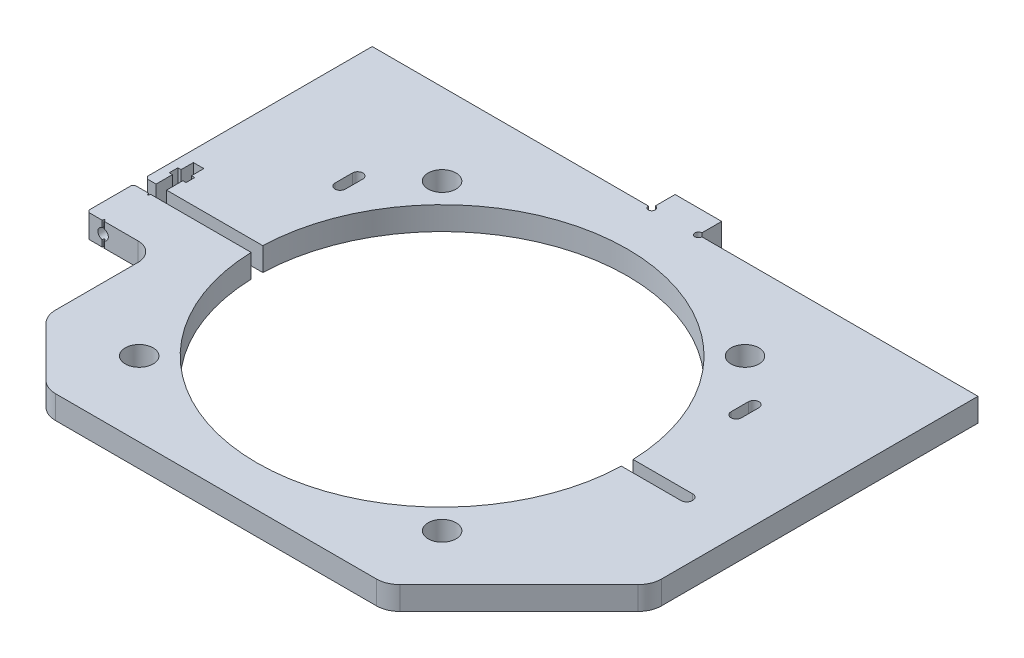
from build123d import *

# Parameters (mm, degrees)
SKETCH1_W                  = 260
SKETCH1_H                  = 200
EXTRUDE1_DEPTH             = 10
SKETCH2_R                  = 79.5
EXTRUDE2_DEPTH             = 10
M4_CLEARANCE_HOLE2_DEPTH   = 10
EXTRUDE3_DEPTH             = 10
SKETCH6_W                  = 30
SKETCH6_H                  = 77.5
EXTRUDE4_DEPTH             = 10
FILLET1_R                  = 8
M4_CLEARANCE_HOLE3_D       = 4.5
M4_CLEARANCE_HOLE3_DEPTH   = 20
EXTRUDE5_DEPTH             = 10
F_12_0_12_DIAMETER_HOLE1_D = 12
CHAMFER1_SIZE              = 30
CHAMFER2_SIZE              = 1
CHAMFER3_SIZE              = 60
SKETCH16_W                 = 146
SKETCH16_H                 = 3
EXTRUDE6_DEPTH             = 10
FILLET4_R                  = 10
EXTRUDE7_DEPTH             = 10
SKETCH18_W                 = 20
SKETCH18_H                 = 10
EXTRUDE8_DEPTH             = 10
EXTRUDE9_DEPTH             = 10


# Read off the part's stored shape, not the designer's step: M4 Clearance Hole2
with BuildPart() as part:
    # Sketch1 → Extrude1 (new body)
    with BuildSketch(Plane(origin=(0, 0, 0), x_dir=(1, 0, 0), z_dir=(0, 1, 0))):
        Rectangle(SKETCH1_W, SKETCH1_H)
    extrude(amount=EXTRUDE1_DEPTH)

    # Sketch2 → Extrude2 (cut)
    with BuildSketch(Plane(origin=(0, 10, 0), x_dir=(1, 0, 0), z_dir=(0, 1, 0))):
        with Locations(Location((0, 0, 0), (0, 0, 270))):
            Circle(SKETCH2_R)
    extrude(amount=-EXTRUDE2_DEPTH, mode=Mode.SUBTRACT)

    # M4 Clearance Hole2 outline → M4 Clearance Hole2 (cut)
    with BuildSketch(Plane(origin=(0, 0, 0), x_dir=(1, 0, 0), z_dir=(0, 1, 0))):
        with BuildLine():
            ThreePointArc((-82.75, 48.75), (-85, 51), (-87.25, 48.75))
            Line((-87.25, 48.75), (-87.25, 41.25))
            ThreePointArc((-87.25, 41.25), (-85, 39), (-82.75, 41.25))
            Line((-82.75, 41.25), (-82.75, 48.75))
        make_face()
        with BuildLine():
            ThreePointArc((87.25, 48.75), (85, 51), (82.75, 48.75))
            Line((82.75, 48.75), (82.75, 41.25))
            ThreePointArc((82.75, 41.25), (85, 39), (87.25, 41.25))
            Line((87.25, 41.25), (87.25, 48.75))
        make_face()
    extrude(amount=M4_CLEARANCE_HOLE2_DEPTH, mode=Mode.SUBTRACT)

    # Sketch5 → Extrude3 (cut)
    with BuildSketch(Plane.XZ):
        with BuildLine():
            Line((-130, 2.5), (105, 2.5))
            ThreePointArc((105, 2.5), (107.5, 0), (105, -2.5))
            Line((105, -2.5), (-130, -2.5))
            Line((-130, -2.5), (-130, 2.5))
        make_face()
    extrude(amount=-EXTRUDE3_DEPTH, mode=Mode.SUBTRACT)

    # Sketch6 → Extrude4 (cut)
    with BuildSketch(Plane.XZ):
        with Locations((-115, 61.25)):
            Rectangle(SKETCH6_W, SKETCH6_H)
    extrude(amount=-EXTRUDE4_DEPTH, mode=Mode.SUBTRACT)

    # Fillet1
    fillet1_edges = [part.edges().sort_by_distance(p)[0] for p in [
        (-100, 5, 22.5),
    ]]
    fillet(fillet1_edges, radius=FILLET1_R)

    # M4 Clearance Hole3
    with Locations(Plane.XY.offset(22.5)):
        with Locations((-123, 5)):
            Hole(M4_CLEARANCE_HOLE3_D / 2, depth=M4_CLEARANCE_HOLE3_DEPTH)

    # Sketch11 → Extrude5 (cut)
    with BuildSketch(Plane.XZ):
        Polygon((-125.25, -2.5), (-125.25, -9.5), (-126.625, -9.5), (-126.625, -13.2), (-125.25, -13.2), (-125.25, -18.5), (-120.75, -18.5), (-120.75, -13.2), (-119.375, -13.2), (-119.375, -9.5), (-120.75, -9.5), (-120.75, -2.5), align=None)
    extrude(amount=-EXTRUDE5_DEPTH, mode=Mode.SUBTRACT)

    # Ø12.0 (12) Diameter Hole1 (through all)
    with Locations(Plane(origin=(-130, 20, 100), x_dir=(1, 0, 0), z_dir=(0, 1, 0))):
        with Locations((65, 165), (195, 165), (195, 35), (65, 35)):
            Hole(F_12_0_12_DIAMETER_HOLE1_D / 2)

    # Chamfer1
    chamfer1_edges = [part.edges().sort_by_distance(p)[0] for p in [
        (-100, 5, 100),
    ]]
    chamfer(chamfer1_edges, length=CHAMFER1_SIZE)

    # Chamfer2
    chamfer2_edges = [part.edges().sort_by_distance(p)[0] for p in [
        (-130, 5, 2.5),
        (-130, 5, -2.5),
        (-130, 5, 22.5),
    ]]
    chamfer(chamfer2_edges, length=CHAMFER2_SIZE)

    # Chamfer3
    chamfer3_edges = [part.edges().sort_by_distance(p)[0] for p in [
        (130, 5, 100),
    ]]
    chamfer(chamfer3_edges, length=CHAMFER3_SIZE)

    # Sketch16 → Extrude6 (cut)
    with BuildSketch(Plane(origin=(0, 10, 0), x_dir=(1, 0, 0), z_dir=(0, 1, 0))):
        with Locations((0, -98.5)):
            Rectangle(SKETCH16_W, SKETCH16_H)
    extrude(amount=-EXTRUDE6_DEPTH, mode=Mode.SUBTRACT)

    # Fillet4
    fillet4_edges = [part.edges().sort_by_distance(p)[0] for p in [
        (-100, 5, 70),
        (130, 5, 40),
        (-73, 5, 97),
        (73, 5, 97),
    ]]
    fillet(fillet4_edges, radius=FILLET4_R)

    # Sketch17 → Extrude7 (cut)
    with BuildSketch(Plane(origin=(0, 10, 0), x_dir=(1, 0, 0), z_dir=(0, 1, 0))):
        Polygon((-122.5, -2.5), (-123.5, -2.5), (-123, -3.5), align=None)
    extrude7 = extrude(amount=-EXTRUDE7_DEPTH, mode=Mode.SUBTRACT)

    # Mirror1: Extrude7 across plane
    add(extrude7.mirror(Plane(origin=(0, 0, 12.5), x_dir=(1, 0, 0), z_dir=(0, 0, -1))), mode=Mode.SUBTRACT)

    # Sketch18 → Extrude8 (add)
    with BuildSketch(Plane(origin=(0, 10, 0), x_dir=(1, 0, 0), z_dir=(0, 1, 0))):
        with Locations((0, 105)):
            Rectangle(SKETCH18_W, SKETCH18_H)
    extrude(amount=-EXTRUDE8_DEPTH)

    # Sketch19 → Extrude9 (cut)
    with BuildSketch(Plane(origin=(0, 10, 0), x_dir=(1, 0, 0), z_dir=(0, 1, 0))):
        with BuildLine():
            Line((-11.5, 100), (-10, 100))
            Line((-10, 100), (-10, 101.5))
            ThreePointArc((-10, 101.5), (-8.939339828, 98.939339828), (-11.5, 100))
        make_face()
        with BuildLine():
            Line((10, 101.5), (10, 100))
            Line((10, 100), (11.5, 100))
            ThreePointArc((11.5, 100), (8.939339828, 98.939339828), (10, 101.5))
        make_face()
    extrude(amount=-EXTRUDE9_DEPTH, mode=Mode.SUBTRACT)


solid = part.part
